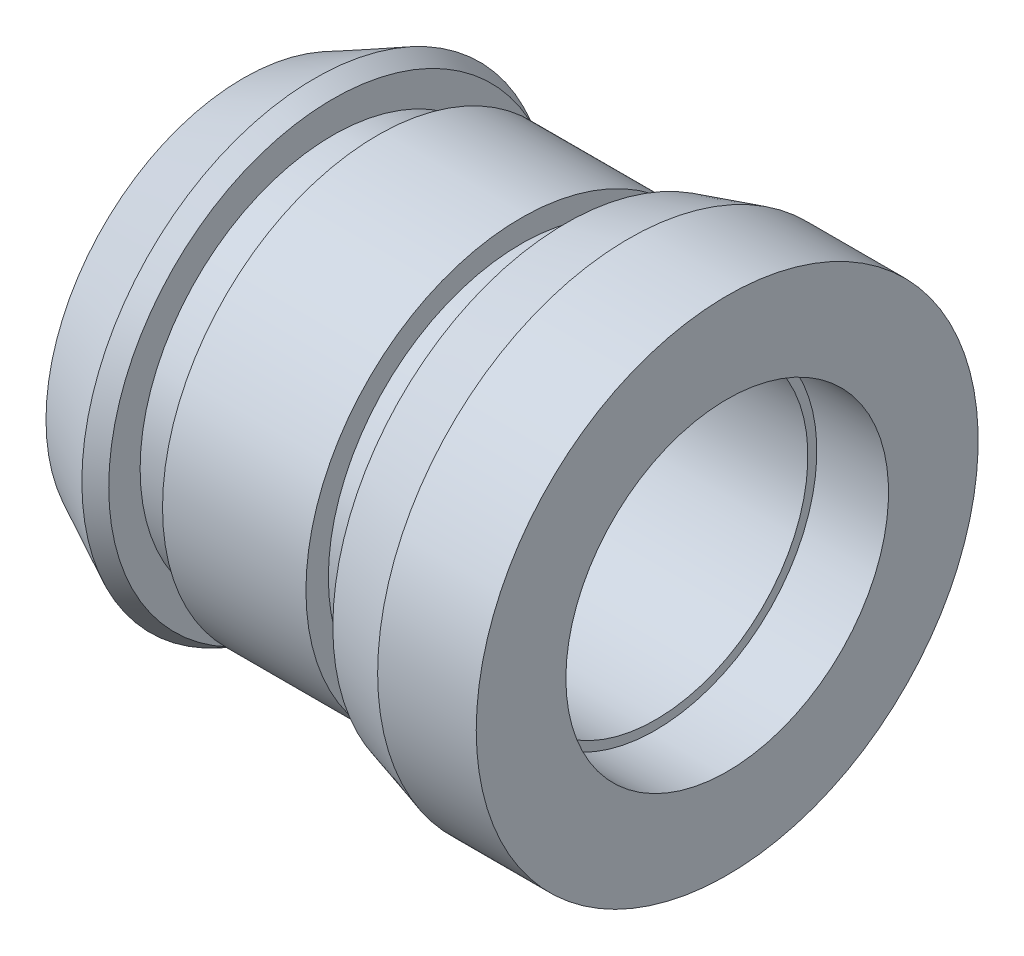
from build123d import *


with BuildPart() as part:
    # Sketch1 → Revolve1 (revolve)
    with BuildSketch(Plane(origin=(0, 0, 0), x_dir=(1, 0, 0), z_dir=(0, 1, 0))):
        Polygon((-49.2125, 26.9875), (-49.2125, 34.925), (-36.5125, 41.275), (-33.3375, 39.6875), (-33.3375, 34.13125), (-25.4, 34.13125), (-25.4, 38.1), (0, 38.1), (0, 34.13125), (7.9375, 34.13125), (7.9375, 41.275), (19.05, 44.45), (36.5125, 44.45), (36.5125, 28.575), (23.8125, 28.575), (23.8125, 26.9875), align=None)
    revolve(axis=Axis((-96.818823529, 0, 0), (1, 0, 0)))


solid = part.part
